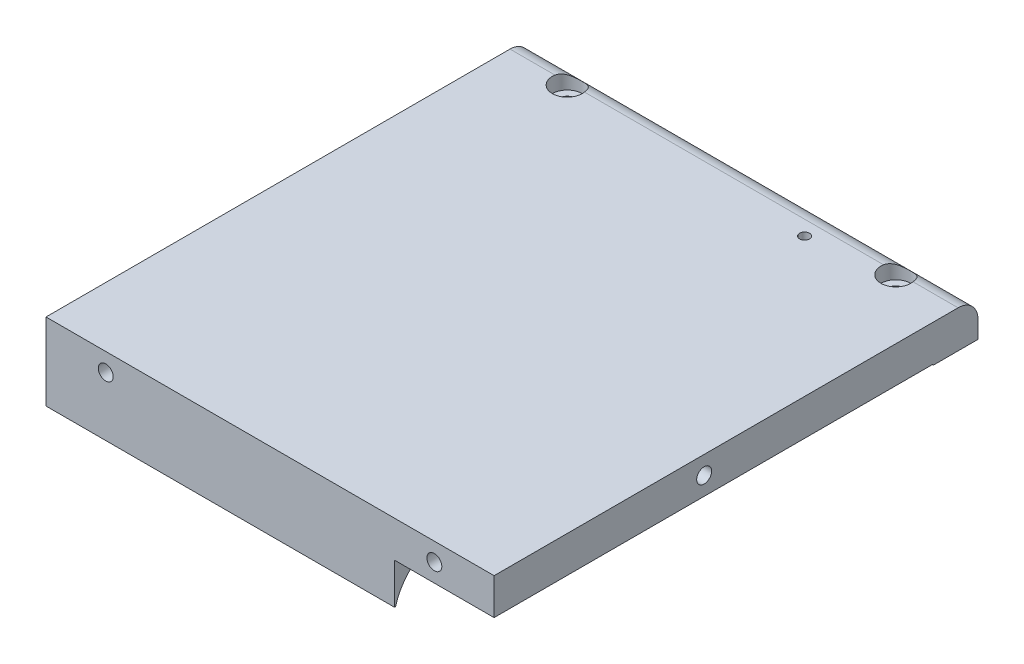
from build123d import *

# Parameters (mm, degrees)
SKETCH_1_W          = 70
SKETCH_1_H          = 110
EXTRUDE_1_DEPTH     = 5
EXTRUDE_2_DEPTH     = 70
SKETCH_3_W          = 12.808674266
SKETCH_3_H          = 5
CUT_EXTRUDE_1_DEPTH = 70
CUT_EXTRUDE_2_REACH = 132.806
SKETCH_4_R          = 11.2
EXTRUDE_3_DEPTH     = 20
SKETCH_6_R          = 1.5
CUT_EXTRUDE_3_DEPTH = 10
SKETCH_7_R          = 1.5
CUT_EXTRUDE_4_DEPTH = 10
CUT_EXTRUDE_5_REACH = 144.969
SKETCH_8_R          = 1.5
SKETCH_9_R          = 3
CUT_EXTRUDE_6_DEPTH = 3
CUT_EXTRUDE_7_REACH = 144.969
SKETCH_10_R         = 1
FILLET_1_R          = 4
SKETCH_11_R         = 1.5
CUT_EXTRUDE_8_DEPTH = 10


with BuildPart() as part:
    # 草图1 → 凸台-拉伸1 (new body)
    with BuildSketch(Plane(origin=(0, 0, 0), x_dir=(1, 0, 0), z_dir=(0, 1, 0))):
        with Locations((35, 55)):
            Rectangle(SKETCH_1_W, SKETCH_1_H)
    extrude(amount=EXTRUDE_1_DEPTH)

    # 草图2 → 凸台-拉伸2 (add)
    with BuildSketch(Plane(origin=(70, 0, 0), x_dir=(0, 0, -1), z_dir=(1, 0, 0))):
        with BuildLine():
            Line((12.808674266, 0), (12.808674266, -10.5))
            Line((12.808674266, -10.5), (13.225674113, -10.5))
            ThreePointArc((13.225674113, -10.5), (23.808674266, -2.500017961), (34.391674418, -10.5))
            Line((34.391674418, -10.5), (35.225674113, -10.5))
            ThreePointArc((35.225674113, -10.5), (45.808674266, -2.500017961), (56.391674418, -10.5))
            Line((56.391674418, -10.5), (57.225674113, -10.5))
            ThreePointArc((57.225674113, -10.5), (67.808674266, -2.500017961), (78.391674418, -10.5))
            Line((78.391674418, -10.5), (79.225674113, -10.5))
            ThreePointArc((79.225674113, -10.5), (83.175432131, -4.725047944), (89.808674266, -2.500017961))
            Line((89.808674266, -2.500017961), (110, -2.500017961))
            Line((110, -2.500017961), (110, 0))
            Line((110, 0), (12.808674266, 0))
        make_face()
    extrude(amount=-EXTRUDE_2_DEPTH)

    # 草图3 → 切除-拉伸1 (cut)
    with BuildSketch(Plane(origin=(70, 0, 0), x_dir=(0, 0, -1), z_dir=(1, 0, 0))):
        with Locations((6.404337133, 2.5)):
            Rectangle(SKETCH_3_W, SKETCH_3_H)
    extrude(amount=-CUT_EXTRUDE_1_DEPTH, mode=Mode.SUBTRACT)

    # 草图4 → 切除-拉伸2 (cut, up to next)
    with BuildSketch(Plane(origin=(70, 0, 0), x_dir=(0, 0, -1), z_dir=(1, 0, 0)), mode=Mode.PRIVATE) as cut_extrude_2_sk1:
        with Locations((23.808674266, -13.500017961)):
            Circle(SKETCH_4_R)
    cut_extrude_2_tool1 = extrude(cut_extrude_2_sk1.sketch, amount=-CUT_EXTRUDE_2_REACH, mode=Mode.PRIVATE) & part.part
    # 草图4 → 切除-拉伸2 (cut, up to next)
    with BuildSketch(Plane(origin=(70, 0, 0), x_dir=(0, 0, -1), z_dir=(1, 0, 0)), mode=Mode.PRIVATE) as cut_extrude_2_sk2:
        with Locations((45.808674266, -13.500017961)):
            Circle(SKETCH_4_R)
    cut_extrude_2_tool2 = extrude(cut_extrude_2_sk2.sketch, amount=-CUT_EXTRUDE_2_REACH, mode=Mode.PRIVATE) & part.part
    # 草图4 → 切除-拉伸2 (cut, up to next)
    with BuildSketch(Plane(origin=(70, 0, 0), x_dir=(0, 0, -1), z_dir=(1, 0, 0)), mode=Mode.PRIVATE) as cut_extrude_2_sk3:
        with Locations((67.808674266, -13.500017961)):
            Circle(SKETCH_4_R)
    cut_extrude_2_tool3 = extrude(cut_extrude_2_sk3.sketch, amount=-CUT_EXTRUDE_2_REACH, mode=Mode.PRIVATE) & part.part
    # 草图4 → 切除-拉伸2 (cut, up to next)
    with BuildSketch(Plane(origin=(70, 0, 0), x_dir=(0, 0, -1), z_dir=(1, 0, 0)), mode=Mode.PRIVATE) as cut_extrude_2_sk4:
        with Locations((89.808674266, -13.500017961)):
            Circle(SKETCH_4_R)
    cut_extrude_2_tool4 = extrude(cut_extrude_2_sk4.sketch, amount=-CUT_EXTRUDE_2_REACH, mode=Mode.PRIVATE) & part.part
    add(cut_extrude_2_tool1.solids().sort_by_distance((70, -13.500018, -23.808674))[0], mode=Mode.SUBTRACT)
    add(cut_extrude_2_tool2.solids().sort_by_distance((70, -13.500018, -45.808674))[0], mode=Mode.SUBTRACT)
    add(cut_extrude_2_tool3.solids().sort_by_distance((70, -13.500018, -67.808674))[0], mode=Mode.SUBTRACT)
    add(cut_extrude_2_tool4.solids().sort_by_distance((70, -13.500018, -89.808674))[0], mode=Mode.SUBTRACT)

    # 草图5 → 凸台-拉伸3 (add)
    with BuildSketch(Plane(origin=(70, 0, 0), x_dir=(0, 0, -1), z_dir=(1, 0, 0))):
        Polygon((12.808674266, 5), (110, 5), (110, -2.300017961), (110, -2.500017961), (101.008674266, -2.500017961), (101.008674266, -2.300017961), (12.808674266, -2.300017961), align=None)
    extrude(amount=EXTRUDE_3_DEPTH)

    # 草图6 → 切除-拉伸3 (cut)
    with BuildSketch(Plane.ZY):
        with Locations((-31, 0.5)):
            Circle(SKETCH_6_R)
        with Locations((-75, 0.5)):
            Circle(SKETCH_6_R)
    extrude(amount=-CUT_EXTRUDE_3_DEPTH, mode=Mode.SUBTRACT)

    # 草图7 → 切除-拉伸4 (cut)
    with BuildSketch(Plane.XY.offset(-12.808674266)):
        with Locations((12, 1.34999102)):
            Circle(SKETCH_7_R)
        with Locations((78, 1.34999102)):
            Circle(SKETCH_7_R)
    extrude(amount=-CUT_EXTRUDE_4_DEPTH, mode=Mode.SUBTRACT)

    # 草图8 → 切除-拉伸5 (cut, up to next)
    with BuildSketch(Plane(origin=(0, 5, 0), x_dir=(1, 0, 0), z_dir=(0, 1, 0)), mode=Mode.PRIVATE) as cut_extrude_5_sk1:
        with Locations(Location((78, 105.504337133, 0), (0, 0, 270))):
            Circle(SKETCH_8_R)
    cut_extrude_5_tool1 = extrude(cut_extrude_5_sk1.sketch, amount=-CUT_EXTRUDE_5_REACH, mode=Mode.PRIVATE) & part.part
    # 草图8 → 切除-拉伸5 (cut, up to next)
    with BuildSketch(Plane(origin=(0, 5, 0), x_dir=(1, 0, 0), z_dir=(0, 1, 0)), mode=Mode.PRIVATE) as cut_extrude_5_sk2:
        with Locations(Location((12, 105.504337133, 0), (0, 0, 270))):
            Circle(SKETCH_8_R)
    cut_extrude_5_tool2 = extrude(cut_extrude_5_sk2.sketch, amount=-CUT_EXTRUDE_5_REACH, mode=Mode.PRIVATE) & part.part
    add(cut_extrude_5_tool1.solids().sort_by_distance((78, 5, -105.504337))[0], mode=Mode.SUBTRACT)
    add(cut_extrude_5_tool2.solids().sort_by_distance((12, 5, -105.504337))[0], mode=Mode.SUBTRACT)

    # 草图9 → 切除-拉伸6 (cut)
    with BuildSketch(Plane(origin=(0, 5, 0), x_dir=(1, 0, 0), z_dir=(0, 1, 0))):
        with Locations(Location((78, 105.504337133, 0), (0, 0, 270))):
            Circle(SKETCH_9_R)
        with Locations(Location((12, 105.504337133, 0), (0, 0, 270))):
            Circle(SKETCH_9_R)
    extrude(amount=-CUT_EXTRUDE_6_DEPTH, mode=Mode.SUBTRACT)

    # 草图10 → 切除-拉伸7 (cut, up to next)
    with BuildSketch(Plane(origin=(0, 5, 0), x_dir=(1, 0, 0), z_dir=(0, 1, 0)), mode=Mode.PRIVATE) as cut_extrude_7_sk1:
        with Locations(Location((62.109, 103.058, 0), (0, 0, 270))):
            Circle(SKETCH_10_R)
    cut_extrude_7_tool1 = extrude(cut_extrude_7_sk1.sketch, amount=-CUT_EXTRUDE_7_REACH, mode=Mode.PRIVATE) & part.part
    add(cut_extrude_7_tool1.solids().sort_by_distance((62.109, 5, -103.058))[0], mode=Mode.SUBTRACT)

    # 圆角1
    # the kernel refuses this fillet: 4 mm, written as the material it takes off along each edge
    with BuildSketch(Plane(origin=(-10, 5, -110), x_dir=(0, -1, 0), z_dir=(1, 0, 0))) as fillet_1_piece_1:
        with BuildLine():
            CenterArc((FILLET_1_R, -FILLET_1_R), FILLET_1_R, 90, 90)
            Line((0, -FILLET_1_R), (0, 0))
            Line((0, 0), (FILLET_1_R, 0))
        make_face()
    extrude(amount=110, mode=Mode.SUBTRACT)

    # 草图11 → 切除-拉伸8 (cut)
    with BuildSketch(Plane(origin=(90, 0, 0), x_dir=(0, 0, -1), z_dir=(1, 0, 0))):
        with Locations((55, 1.34999102)):
            Circle(SKETCH_11_R)
    extrude(amount=-CUT_EXTRUDE_8_DEPTH, mode=Mode.SUBTRACT)


solid = part.part
